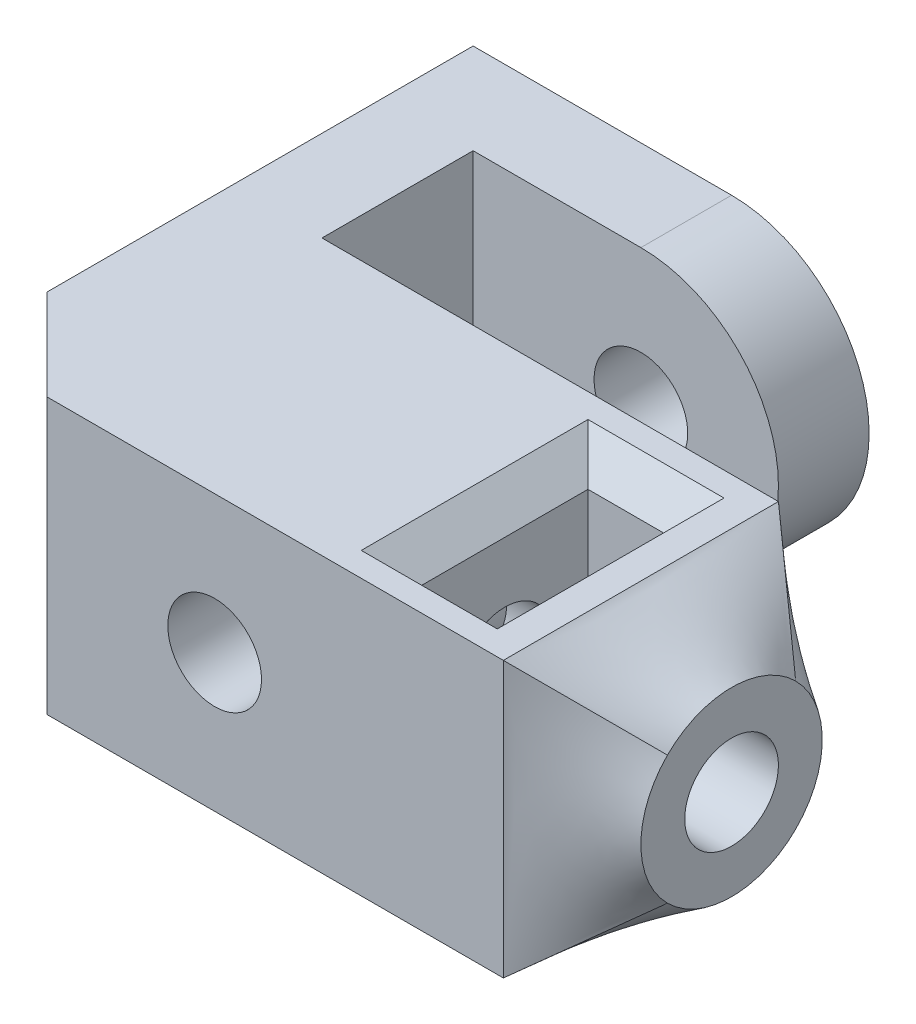
from build123d import *

# Parameters (mm, degrees)
SKETCH1_R               = 4.55
SKETCH1_R_2             = 1.55
BOSS_EXTRUDE1_DEPTH     = 9.1
SKETCH2_R               = 1.55
BOSS_EXTRUDE2_DEPTH     = 3
SKETCH3_W               = 17.1
SKETCH3_H               = 9.1
BOSS_EXTRUDE3_DEPTH     = 3
CUT_EXTRUDE1_REACH      = 26.036
CUT_EXTRUDE1_END_RADIUS = 3.55
SKETCH4_R               = 1.55
SKETCH5_R               = 1.55
CUT_EXTRUDE2_DEPTH      = 2.5
CHAMFER1_SIZE           = 1
CHAMFER2_SIZE           = 3


with BuildPart() as part:
    # Sketch1 → Boss-Extrude1 (new body)
    # profile 1 of 3: a face of its own
    with BuildSketch(Plane.XY):
        with Locations((-94.564189657, 2.5)):
            Circle(SKETCH1_R)
        with Locations((-94.564189657, 2.5)):
            Circle(SKETCH1_R_2, mode=Mode.SUBTRACT)
    # profile 2 of 3: a face of its own
    with BuildSketch(Plane.XY):
        with BuildLine():
            ThreePointArc((-94.564189657, -2.05), (-99.114189657, 2.5), (-94.564189657, 7.05))
            Line((-94.564189657, 7.05), (-100.114189657, 7.05))
            Line((-100.114189657, 7.05), (-100.114189657, -2.05))
            Line((-100.114189657, -2.05), (-94.564189657, -2.05))
        make_face()
    # profile 3 of 3: a face of its own
    with BuildSketch(Plane.XY):
        with BuildLine():
            Line((-85.014189657, 7.05), (-94.564189657, 7.05))
            ThreePointArc((-94.564189657, 7.05), (-91.346853802, 5.717335854), (-90.014189657, 2.5))
            ThreePointArc((-90.014189657, 2.5), (-91.346853802, -0.717335854), (-94.564189657, -2.05))
            Line((-94.564189657, -2.05), (-85.014189657, -2.05))
            Line((-85.014189657, -2.05), (-85.014189657, 7.05))
        make_face()
    extrude(amount=BOSS_EXTRUDE1_DEPTH)



with BuildPart() as body_2:
    # Sketch2 → Boss-Extrude2 (new body)
    # profile 1 of 2: a face of its own
    with BuildSketch(Plane(origin=(0, 0, -5), x_dir=(-1, 0, 0), z_dir=(0, 0, -1))):
        with BuildLine():
            ThreePointArc((99.114189657, 2.5), (97.781525511, 5.717335854), (94.564189657, 7.05))
            ThreePointArc((94.564189657, 7.05), (90.014189657, 2.5), (94.564189657, -2.05))
            ThreePointArc((94.564189657, -2.05), (97.781525511, -0.717335854), (99.114189657, 2.5))
        make_face()
        with Locations(Location((94.564189657, 2.5, 0), (0, 0, 180))):
            Circle(SKETCH2_R, mode=Mode.SUBTRACT)
    # profile 2 of 2: a face of its own
    with BuildSketch(Plane(origin=(0, 0, -5), x_dir=(-1, 0, 0), z_dir=(0, 0, -1))):
        with BuildLine():
            Line((100.114189657, -2.05), (100.114189657, 7.05))
            Line((100.114189657, 7.05), (94.564189657, 7.05))
            ThreePointArc((94.564189657, 7.05), (97.781525511, 5.717335854), (99.114189657, 2.5))
            ThreePointArc((99.114189657, 2.5), (97.781525511, -0.717335854), (94.564189657, -2.05))
            Line((94.564189657, -2.05), (100.114189657, -2.05))
        make_face()
    extrude(amount=BOSS_EXTRUDE2_DEPTH)


with BuildPart() as part_1:
    add(part.part)

    add(body_2.part)  # Boss-Extrude3 merges body 2
    # Sketch3 → Boss-Extrude3 (add)
    with BuildSketch(Plane.ZY.offset(100.114189657)):
        with Locations((0.55, 2.5)):
            Rectangle(SKETCH3_W, SKETCH3_H)
    extrude(amount=BOSS_EXTRUDE3_DEPTH)

    # Loft1: read off the stored shape, not the designer's step
    # Loft1: loft between two sections, ruled curve by curve
    loft1_from = [
        Edge.make_bspline([(-85.014189657, -2.05, 9.1), (-85.014189657, -2.05, 8.341666667), (-85.014189657, -2.05, 7.583333333), (-85.014189657, -2.05, 6.066666667), (-85.014189657, -2.05, 5.308333333), (-85.014189657, -2.05, 3.791666667), (-85.014189657, -2.05, 3.033333333), (-85.014189657, -2.05, 1.516666667), (-85.014189657, -2.05, 0.758333333), (-85.014189657, -2.05, 0)], [0, 0, 0, 0, 0.25, 0.25, 0.5, 0.5, 0.75, 0.75, 1, 1, 1, 1], 3),
        Edge.make_bspline([(-85.014189657, -2.05, 0), (-85.014189657, -1.291666667, 0), (-85.014189657, -0.533333333, 0), (-85.014189657, 0.983333333, 0), (-85.014189657, 1.741666667, 0), (-85.014189657, 3.258333333, 0), (-85.014189657, 4.016666667, 0), (-85.014189657, 5.533333333, 0), (-85.014189657, 6.291666667, 0), (-85.014189657, 7.05, 0)], [0, 0, 0, 0, 0.25, 0.25, 0.5, 0.5, 0.75, 0.75, 1, 1, 1, 1], 3),
        Edge.make_bspline([(-85.014189657, 7.05, 9.1), (-85.014189657, 6.291666667, 9.1), (-85.014189657, 5.533333333, 9.1), (-85.014189657, 4.016666667, 9.1), (-85.014189657, 3.258333333, 9.1), (-85.014189657, 1.741666667, 9.1), (-85.014189657, 0.983333333, 9.1), (-85.014189657, -0.533333333, 9.1), (-85.014189657, -1.291666667, 9.1), (-85.014189657, -2.05, 9.1)], [0, 0, 0, 0, 0.25, 0.25, 0.5, 0.5, 0.75, 0.75, 1, 1, 1, 1], 3),
        Edge.make_bspline([(-85.014189657, 7.05, 0), (-85.014189657, 7.05, 0.758333333), (-85.014189657, 7.05, 1.516666667), (-85.014189657, 7.05, 3.033333333), (-85.014189657, 7.05, 3.791666667), (-85.014189657, 7.05, 5.308333333), (-85.014189657, 7.05, 6.066666667), (-85.014189657, 7.05, 7.583333333), (-85.014189657, 7.05, 8.341666667), (-85.014189657, 7.05, 9.1)], [0, 0, 0, 0, 0.25, 0.25, 0.5, 0.5, 0.75, 0.75, 1, 1, 1, 1], 3),
    ]
    loft1_to = [
        Edge.make_bspline([(-82.014189657, 0.378679656, 6.671320344), (-82.014189657, 0.128679656, 6.421320344), (-82.014189657, -0.095475789, 6.106038327), (-82.014189657, -0.410975479, 5.377025758), (-82.014189657, -0.5, 4.964213562), (-82.014189657, -0.5, 4.135786438), (-82.014189657, -0.410975479, 3.722974242), (-82.014189657, -0.095475789, 2.993961673), (-82.014189657, 0.128679656, 2.678679656), (-82.014189657, 0.378679656, 2.428679656)], [0, 0, 0, 0, 0.25, 0.25, 0.5, 0.5, 0.75, 0.75, 1, 1, 1, 1], 3),
        Edge.make_bspline([(-82.014189657, 0.378679656, 2.428679656), (-82.014189657, 0.628679656, 2.178679656), (-82.014189657, 0.943961673, 1.954524211), (-82.014189657, 1.672974242, 1.639024521), (-82.014189657, 2.085786438, 1.55), (-82.014189657, 2.914213562, 1.55), (-82.014189657, 3.327025758, 1.639024521), (-82.014189657, 4.056038327, 1.954524211), (-82.014189657, 4.371320344, 2.178679656), (-82.014189657, 4.621320344, 2.428679656)], [0, 0, 0, 0, 0.25, 0.25, 0.5, 0.5, 0.75, 0.75, 1, 1, 1, 1], 3),
        Edge.make_bspline([(-82.014189657, 4.621320344, 6.671320344), (-82.014189657, 4.371320344, 6.921320344), (-82.014189657, 4.056038327, 7.145475789), (-82.014189657, 3.327025758, 7.460975479), (-82.014189657, 2.914213562, 7.55), (-82.014189657, 2.085786438, 7.55), (-82.014189657, 1.672974242, 7.460975479), (-82.014189657, 0.943961673, 7.145475789), (-82.014189657, 0.628679656, 6.921320344), (-82.014189657, 0.378679656, 6.671320344)], [0, 0, 0, 0, 0.25, 0.25, 0.5, 0.5, 0.75, 0.75, 1, 1, 1, 1], 3),
        Edge.make_bspline([(-82.014189657, 4.621320344, 2.428679656), (-82.014189657, 4.871320344, 2.678679656), (-82.014189657, 5.095475789, 2.993961673), (-82.014189657, 5.410975479, 3.722974242), (-82.014189657, 5.5, 4.135786438), (-82.014189657, 5.5, 4.964213562), (-82.014189657, 5.410975479, 5.377025758), (-82.014189657, 5.095475789, 6.106038327), (-82.014189657, 4.871320344, 6.421320344), (-82.014189657, 4.621320344, 6.671320344)], [0, 0, 0, 0, 0.25, 0.25, 0.5, 0.5, 0.75, 0.75, 1, 1, 1, 1], 3),
    ]
    loft1 = Solid(Shell([*[Face.make_surface_from_curves(loft1_from[k], loft1_to[k]) for k in range(4)], Face(Wire(loft1_from)), Face(Wire(loft1_to))]))
    add(loft1)

    # Cut-Extrude1: up to this cylinder (the profile starts outside it)
    cut_extrude1_end = Plane(origin=(-94.564189657, 2.5, 4.55), z_dir=(0, 0, -1)) * Cylinder(CUT_EXTRUDE1_END_RADIUS, 60.172, mode=Mode.PRIVATE)
    # Sketch4 → Cut-Extrude1 (cut, up to the surface)
    with BuildSketch(Plane(origin=(-82.014189657, 0, 0), x_dir=(0, 0, -1), z_dir=(1, 0, 0)), mode=Mode.PRIVATE) as cut_extrude1_sk1:
        with Locations((-4.55, 2.5)):
            Circle(SKETCH4_R)
    cut_extrude1_tool1 = extrude(cut_extrude1_sk1.sketch, amount=-CUT_EXTRUDE1_REACH, mode=Mode.PRIVATE) - cut_extrude1_end
    add(cut_extrude1_tool1.solids().sort_by_distance((-82.01419, 2.5, 4.55))[0], mode=Mode.SUBTRACT)

    # Sketch5 → Cut-Extrude2 (cut)
    # profile 1 of 2: a face of its own
    with BuildSketch(Plane.ZY.offset(87.014189657)):
        Polygon((4.55, 5.675426481), (7.3, 4.08771324), (7.3, 7.05), (1.8, 7.05), (1.8, 4.08771324), align=None)
    # profile 2 of 2: a face of its own
    with BuildSketch(Plane.ZY.offset(87.014189657)):
        Polygon((7.3, 0.91228676), (7.3, 4.08771324), (4.55, 5.675426481), (1.8, 4.08771324), (1.8, 0.91228676), (4.55, -0.675426481), align=None)
        with Locations(Location((4.55, 2.5, 0), (0, 0, 180))):
            Circle(SKETCH5_R, mode=Mode.SUBTRACT)
    extrude(amount=CUT_EXTRUDE2_DEPTH, mode=Mode.SUBTRACT)

    # Chamfer1
    chamfer1_edges = [part_1.edges().sort_by_distance(p)[0] for p in [
        (-87.014189657, 7.05, 4.55),
        (-88.264189657, 7.05, 7.3),
        (-88.264189657, 7.05, 1.8),
        (-89.514189657, 7.05, 4.55),
    ]]
    chamfer(chamfer1_edges, length=CHAMFER1_SIZE)

    # Chamfer2
    chamfer2_edges = [part_1.edges().sort_by_distance(p)[0] for p in [
        (-103.114189657, 2.5, 9.1),
    ]]
    chamfer(chamfer2_edges, length=CHAMFER2_SIZE)


solid = part_1.part
